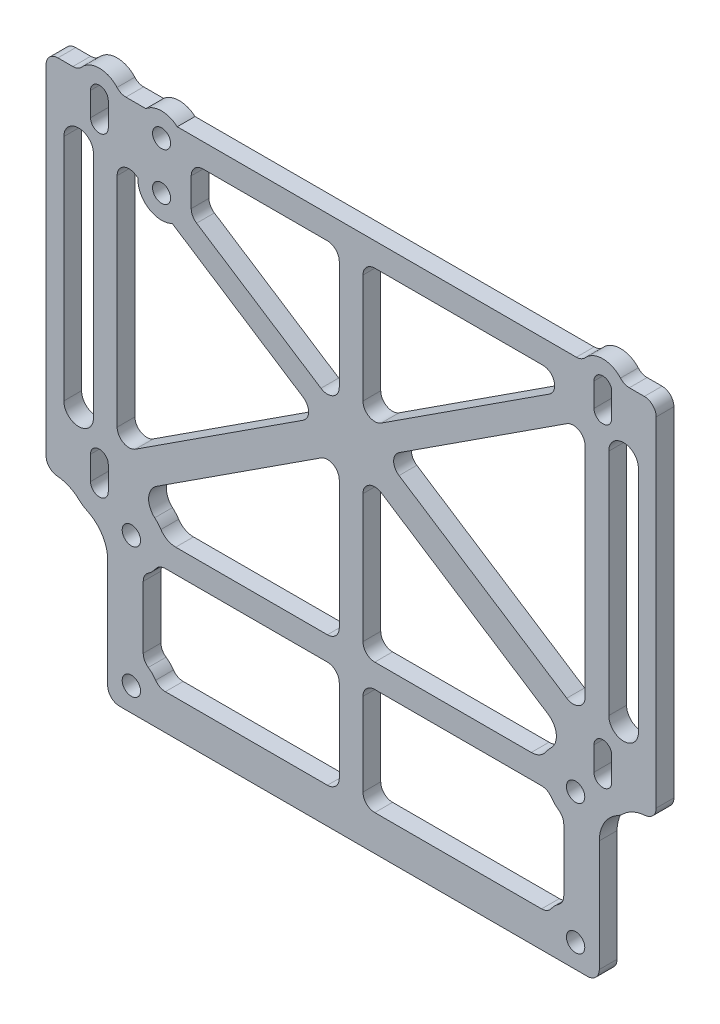
from build123d import *

# Parameters (mm, degrees)
SKETCH_1_W          = 103
SKETCH_1_H          = 61.2
EXTRUDE_1_DEPTH     = 3
SKETCH_2_R          = 1.5
SKETCH_2_R_2        = 1.525
CUT_EXTRUDE_1_DEPTH = 10
SKETCH_3_W          = 83
SKETCH_3_H          = 28.4
SKETCH_3_R          = 1.55
EXTRUDE_2_DEPTH     = 3
CUT_EXTRUDE_5_DEPTH = 10
FILLET_1_R          = 2
CUT_EXTRUDE_2_DEPTH = 10
FILLET_3_R          = 2
CUT_EXTRUDE_3_DEPTH = 10
EXTRUDE_3_DEPTH     = 3
FILLET_2_R          = 2
CUT_EXTRUDE_4_DEPTH = 10
FILLET_4_R          = 3
FILLET_6_R          = 6
SKETCH_11_W         = 4
SKETCH_11_H         = 82.358538581
EXTRUDE_4_DEPTH     = 3
FILLET_7_R          = 2


with BuildPart() as part:
    # 草图1 → 凸台-拉伸1 (new body)
    with BuildSketch(Plane.XY):
        Rectangle(SKETCH_1_W, SKETCH_1_H)
    extrude(amount=EXTRUDE_1_DEPTH)

    # 草图2 → 切除-拉伸1 (cut)
    with BuildSketch(Plane(origin=(0, 0, 0), x_dir=(-1, 0, 0), z_dir=(0, 0, -1))):
        with Locations((-42.5, 27.6)):
            Circle(SKETCH_2_R)
        with Locations((-42.5, -27.6)):
            Circle(SKETCH_2_R)
        with Locations((42.499997562, -27.6)):
            Circle(SKETCH_2_R)
        with Locations((42.499997562, 27.6)):
            Circle(SKETCH_2_R)
        with Locations((32, 27.6)):
            Circle(SKETCH_2_R_2)
        with Locations((32, 19.6)):
            Circle(SKETCH_2_R_2)
        Polygon((-39.5, 22.074667925), (-39.5, -22.074667925), (-5.508211597, 0), align=None)
        Polygon((-1.219e-06, -2.38473115), (-35.748149691, -25.6), (35.748147253, -25.6), align=None)
        Polygon((39.499997562, 22.074667925), (5.50820916, 0), (39.499997562, -22.074667925), align=None)
        with BuildLine():
            Line((-43.5, 19.6), (-43.5, -19.059996805))
            ThreePointArc((-43.5, -19.059996805), (-46, -21.559996805), (-48.5, -19.059996805))
            Line((-48.5, -19.059996805), (-48.5, 19.6))
            ThreePointArc((-48.5, 19.6), (-46, 22.1), (-43.5, 19.6))
        make_face()
        with BuildLine():
            Line((43.5, 19.6), (43.5, -19.059996805))
            ThreePointArc((43.5, -19.059996805), (46, -21.559996805), (48.5, -19.059996805))
            Line((48.5, -19.059996805), (48.5, 19.6))
            ThreePointArc((48.5, 19.6), (46, 22.1), (43.5, 19.6))
        make_face()
    extrude(amount=-CUT_EXTRUDE_1_DEPTH, mode=Mode.SUBTRACT)

    # 草图3 → 凸台-拉伸2 (add)
    with BuildSketch(Plane.XY.offset(3)):
        with Locations((0.4, -44.8)):
            Rectangle(SKETCH_3_W, SKETCH_3_H)
        with Locations((-37.1, -33)):
            Circle(SKETCH_3_R, mode=Mode.SUBTRACT)
        with Locations((-37.1, -55)):
            Circle(SKETCH_3_R, mode=Mode.SUBTRACT)
        with Locations((37.9, -55)):
            Circle(SKETCH_3_R, mode=Mode.SUBTRACT)
        with Locations((37.9, -33)):
            Circle(SKETCH_3_R, mode=Mode.SUBTRACT)
    extrude(amount=-EXTRUDE_2_DEPTH)

    # 草图10 → 切除-拉伸5 (cut)
    with BuildSketch(Plane(origin=(0, 0, 0), x_dir=(-1, 0, 0), z_dir=(0, 0, -1))):
        Polygon((-39.124074846, 26.6), (27, 26.6), (27, 18.726482933), (0, 1.192364783), align=None)
    extrude(amount=-CUT_EXTRUDE_5_DEPTH, mode=Mode.SUBTRACT)

    # 圆角1
    fillet_1_edges = [part.edges().sort_by_distance(p)[0] for p in [
        (0, 1.192364783, 1.5),
        (39.124074846, 26.6, 1.5),
        (-27, 26.6, 1.5),
        (-27, 18.726482933, 1.5),
        (-39.499997562, 22.074667925, 1.5),
        (-39.499997562, -22.074667925, 1.5),
        (-5.50820916, 0, 1.5),
        (1.219e-06, -2.38473115, 1.5),
        (-35.748147253, -25.6, 1.5),
        (35.748149691, -25.6, 1.5),
        (39.5, 22.074667925, 1.5),
        (5.508211597, 0, 1.5),
        (39.5, -22.074667925, 1.5),
        (-51.5, 30.6, 1.5),
        (51.5, 30.6, 1.5),
        (51.5, -30.6, 1.5),
        (-51.5, -30.6, 1.5),
    ]]
    fillet(fillet_1_edges, radius=FILLET_1_R)

    # 草图4 → 切除-拉伸2 (cut)
    with BuildSketch(Plane.XY.offset(3)):
        with BuildLine():
            ThreePointArc((-32.517424305, -35), (-33.564466094, -36.535533906), (-35.1, -37.582575695))
            Line((-35.1, -37.582575695), (-35.1, -50.417424305))
            ThreePointArc((-35.1, -50.417424305), (-33.564466094, -51.464466094), (-32.517424305, -53))
            Line((-32.517424305, -53), (33.317424305, -53))
            ThreePointArc((33.317424305, -53), (34.364466094, -51.464466094), (35.9, -50.417424305))
            Line((35.9, -50.417424305), (35.9, -37.582575695))
            ThreePointArc((35.9, -37.582575695), (34.364466094, -36.535533906), (33.317424305, -35))
            Line((33.317424305, -35), (-32.517424305, -35))
        make_face()
    extrude(amount=-CUT_EXTRUDE_2_DEPTH, mode=Mode.SUBTRACT)

    # 圆角3
    fillet_3_edges = [part.edges().sort_by_distance(p)[0] for p in [
        (35.9, -50.417424305, 1.5),
        (33.317424305, -53, 1.5),
        (-32.517424305, -53, 1.5),
        (-35.1, -50.417424305, 1.5),
        (-35.1, -37.582575695, 1.5),
        (-32.517424305, -35, 1.5),
        (33.317424305, -35, 1.5),
        (35.9, -37.582575695, 1.5),
    ]]
    fillet(fillet_3_edges, radius=FILLET_3_R)

    # 草图6 → 切除-拉伸3 (cut)
    with BuildSketch(Plane.XY.offset(3)):
        with BuildLine():
            Line((-40.999997562, 28.6), (-40.999997562, 24.6))
            ThreePointArc((-40.999997562, 24.6), (-42.499997562, 23.1), (-43.999997562, 24.6))
            Line((-43.999997562, 24.6), (-43.999997562, 28.6))
            ThreePointArc((-43.999997562, 28.6), (-42.499997562, 30.1), (-40.999997562, 28.6))
        make_face()
        with BuildLine():
            Line((-40.999997562, -28.6), (-40.999997562, -24.6))
            ThreePointArc((-40.999997562, -24.6), (-42.499997562, -23.1), (-43.999997562, -24.6))
            Line((-43.999997562, -24.6), (-43.999997562, -28.6))
            ThreePointArc((-43.999997562, -28.6), (-42.499997562, -30.1), (-40.999997562, -28.6))
        make_face()
        with BuildLine():
            Line((40.999997562, -28.6), (40.999997562, -24.6))
            ThreePointArc((40.999997562, -24.6), (42.499997562, -23.1), (43.999997562, -24.6))
            Line((43.999997562, -24.6), (43.999997562, -28.6))
            ThreePointArc((43.999997562, -28.6), (42.499997562, -30.1), (40.999997562, -28.6))
        make_face()
        with BuildLine():
            Line((40.999997562, 28.6), (40.999997562, 24.6))
            ThreePointArc((40.999997562, 24.6), (42.499997562, 23.1), (43.999997562, 24.6))
            Line((43.999997562, 24.6), (43.999997562, 28.6))
            ThreePointArc((43.999997562, 28.6), (42.499997562, 30.1), (40.999997562, 28.6))
        make_face()
    extrude(amount=-CUT_EXTRUDE_3_DEPTH, mode=Mode.SUBTRACT)

    # 草图7 → 凸台-拉伸3 (add)
    with BuildSketch(Plane.XY.offset(3)):
        with BuildLine():
            Line((39.035895947, 30.6), (45.964099177, 30.6))
            ThreePointArc((45.964099177, 30.6), (42.499997562, 32.6), (39.035895947, 30.6))
        make_face()
        with BuildLine():
            Line((-34.645751311, 30.6), (-29.354248689, 30.6))
            ThreePointArc((-29.354248689, 30.6), (-32, 31.6), (-34.645751311, 30.6))
        make_face()
        with BuildLine():
            ThreePointArc((41.9, -33.563869753), (44.982206885, -32.940349856), (47.082573257, -30.6))
            Line((47.082573257, -30.6), (41.9, -30.6))
            Line((41.9, -30.6), (41.9, -33.563869753))
        make_face()
        with BuildLine():
            Line((-45.964099177, 30.6), (-39.035895947, 30.6))
            ThreePointArc((-39.035895947, 30.6), (-42.499997562, 32.6), (-45.964099177, 30.6))
        make_face()
        with BuildLine():
            Line((-30.193716195, 16.031059146), (-35.995070346, 19.798526892))
            ThreePointArc((-35.995070346, 19.798526892), (-34.178566027, 16.245324149), (-30.193716195, 16.031059146))
        make_face()
        with BuildLine():
            ThreePointArc((-47.082573257, -30.6), (-44.619479076, -33.128553645), (-41.1, -33.400000711))
            Line((-41.1, -33.400000711), (-41.1, -30.6))
            Line((-41.1, -30.6), (-47.082573257, -30.6))
        make_face()
    extrude(amount=-EXTRUDE_3_DEPTH)

    # 圆角2
    fillet_2_edges = [part.edges().sort_by_distance(p)[0] for p in [
        (-41.1, -59, 1.5),
        (41.9, -59, 1.5),
        (-39.035895947, 30.6, 1.5),
        (-45.964099177, 30.6, 1.5),
        (45.964099177, 30.6, 1.5),
        (39.035895947, 30.6, 1.5),
    ]]
    fillet(fillet_2_edges, radius=FILLET_2_R)

    # 草图8 → 切除-拉伸4 (cut)
    with BuildSketch(Plane.XY.offset(3)):
        with BuildLine():
            Line((0, -31), (0, -2.384731941))
            Line((0, -2.384731941), (-38.011080882, -27.069575763))
            ThreePointArc((-38.011080882, -27.069575763), (-34.018985575, -27.851471073), (-31.443145751, -31))
            Line((-31.443145751, -31), (0, -31))
        make_face()
        with BuildLine():
            Line((37.903948732, -27.000001299), (0, -2.384731941))
            Line((0, -2.384731941), (0, -31))
            Line((0, -31), (32.243145751, -31))
            ThreePointArc((32.243145751, -31), (34.437510635, -28.099880879), (37.903948732, -27.000001299))
        make_face()
    extrude(amount=-CUT_EXTRUDE_4_DEPTH, mode=Mode.SUBTRACT)

    # 圆角4
    # the kernel refuses this fillet: 3 mm, written as the material it adds along each edge
    with BuildSketch(Plane(origin=(32.243145751, -31, 3), x_dir=(0.4479167728471886, 0.8940752566770652, 0), z_dir=(0, 0, -1))) as fillet_4_piece_1:
        with BuildLine():
            CenterArc((1.864123466, -2.97674348), FILLET_4_R, 97.138883981, 56.251011404)
            Line((-0.818102304, -1.632993162), (-0.871746819, -1.606118155))
            Line((-0.871746819, -1.606118155), (-0.053644515, 0.026875006))
            Line((-0.053644515, 0.026875006), (0.007456494, 0.05953487))
            ThreePointArc((0.007456494, 0.05953487), (0.745649387, 0.013486961), (1.483842279, 0.05953487))
            Line((1.483842279, 0.05953487), (1.491298773, 0))
        make_face()
    extrude(amount=3)
    with BuildSketch(Plane(origin=(-31.443145751, -31, 3), x_dir=(1, 0, 0), z_dir=(0, 0, -1))) as fillet_4_piece_2:
        with BuildLine():
            CenterArc((1.826460524, -3), FILLET_4_R, 90, 56.251011404)
            Line((-0.667977734, -1.333333333), (-0.717866499, -1.3))
            ThreePointArc((-0.717866499, -1.3), (-0.346047225, -0.660625631), (-0.056568542, 0.02))
            Line((-0.056568542, 0.02), (0, 0.06))
            Line((0, 0.06), (1.826460524, 0.06))
            Line((1.826460524, 0.06), (1.826460524, 0))
        make_face()
    extrude(amount=3)
    with BuildSketch(Plane(origin=(37.903948732, -27.000001299, 3), x_dir=(-0.8386689787810934, 0.5446414821056857, 0), z_dir=(0, 0, -1))) as fillet_4_piece_3:
        with BuildLine():
            CenterArc((5.502571293, -3), FILLET_4_R, 90, 103.062756756)
            Line((2.580202026, -3.678054475), (2.521754641, -3.691615565))
            ThreePointArc((2.521754641, -3.691615565), (1.598242731, -1.622861901), (-0.032645365, -0.050341634))
            Line((-0.032645365, -0.050341634), (0, 0.06))
            Line((0, 0.06), (5.502571293, 0.06))
            Line((5.502571293, 0.06), (5.502571293, 0))
        make_face()
    extrude(amount=3)
    with BuildSketch(Plane(origin=(-38.011080882, -27.069575763, 3), x_dir=(0.9604450270381002, -0.278469657301802, 0), z_dir=(0, 0, -1))) as fillet_4_piece_4:
        with BuildLine():
            CenterArc((6.316215768, -2.721069043), FILLET_4_R, 114.902857597, 105.92808325)
            Line((4.046289512, -4.682556945), (4.000890987, -4.721786703))
            Line((4.000890987, -4.721786703), (-0.045398525, -0.039229758))
            Line((-0.045398525, -0.039229758), (0.025264863, 0.054421381))
            ThreePointArc((0.025264863, 0.054421381), (2.526486307, -0.497861915), (5.027707751, 0.054421381))
            Line((5.027707751, 0.054421381), (5.052972614, 0))
        make_face()
    extrude(amount=3)
    with BuildSketch(Plane(origin=(0, -2.384731941, 3), x_dir=(-0.8386689627806916, -0.5446415067439856, 0), z_dir=(0, 0, -1))) as fillet_4_piece_5:
        with BuildLine():
            CenterArc((FILLET_4_R * 0.649411762447, -FILLET_4_R), FILLET_4_R, 90, 66.000336041)
            Line((-FILLET_4_R * 0.2641360807, -FILLET_4_R * 0.593268714899), (-FILLET_4_R * 0.282407037563, -FILLET_4_R * 0.585134089197))
            Line((-FILLET_4_R * 0.282407037563, -FILLET_4_R * 0.585134089197), (-FILLET_4_R * 0.0129882352489, FILLET_4_R * 0.02))
            Line((-FILLET_4_R * 0.0129882352489, FILLET_4_R * 0.02), (FILLET_4_R * 0.649411762447, FILLET_4_R * 0.02))
            Line((FILLET_4_R * 0.649411762447, FILLET_4_R * 0.02), (FILLET_4_R * 0.649411762447, 0))
        make_face()
    extrude(amount=3)

    # 圆角6
    fillet_6_edges = [part.edges().sort_by_distance(p)[0] for p in [
        (-47.082573257, -30.6, 1.5),
        (47.082573257, -30.6, 1.5),
        (41.9, -33.563869753, 1.5),
        (-41.1, -33.400000711, 1.5),
    ]]
    fillet(fillet_6_edges, radius=FILLET_6_R)

    # 草图11 → 凸台-拉伸4 (add)
    with BuildSketch(Plane.XY.offset(3)):
        with Locations((0, -14.579269291)):
            Rectangle(SKETCH_11_W, SKETCH_11_H)
    extrude(amount=-EXTRUDE_4_DEPTH)

    # 圆角7
    fillet_7_edges = [part.edges().sort_by_distance(p)[0] for p in [
        (-2, -31, 1.5),
        (2, -31, 1.5),
        (2, 26.6, 1.5),
        (2, -53, 1.5),
        (2, -3.683553925, 1.5),
        (2, 2.49118835, 1.5),
        (-2, -53, 1.5),
        (-2, -3.683555508, 1.5),
        (-2, 2.49118835, 1.5),
        (-2, 26.6, 1.5),
        (2, -35, 1.5),
        (-2, -35, 1.5),
    ]]
    fillet(fillet_7_edges, radius=FILLET_7_R)


solid = part.part
